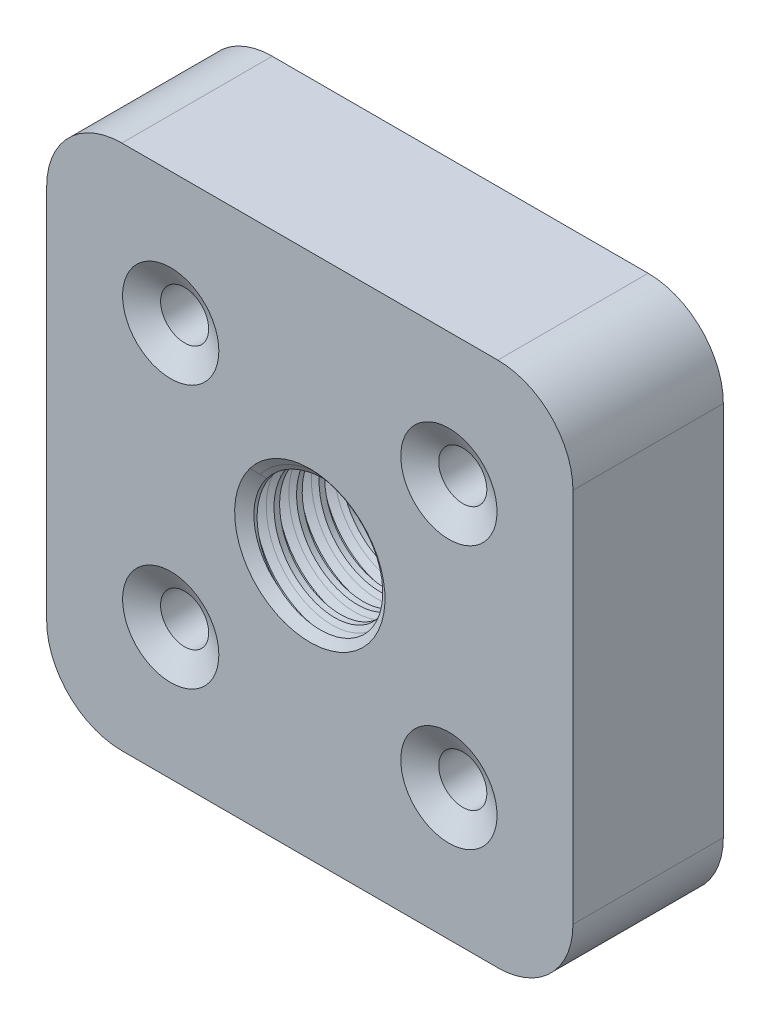
from build123d import *

# Parameters (mm, degrees)
SKETCH1_W                    = 35
SKETCH1_H                    = 35
SKETCH1_R                    = 4.188
SKETCH1_R_2                  = 1.6
BOSS_EXTRUDE1_DEPTH          = 10
CUT_SWEEP1_PITCH             = 1.5
FILLET1_R                    = 5
SKETCH5_R                    = 3.2
CUT_EXTRUDE1_DEPTH           = 1
CUT_EXTRUDE1_DRAFT           = -60
CUT_EXTRUDE1_PROFILE_2_DEPTH = 1
CUT_EXTRUDE1_PROFILE_2_DRAFT = -60
CUT_EXTRUDE1_PROFILE_3_DEPTH = 1
CUT_EXTRUDE1_PROFILE_3_DRAFT = -60
CUT_EXTRUDE1_PROFILE_4_DEPTH = 1
CUT_EXTRUDE1_PROFILE_4_DRAFT = -60


with BuildPart() as part:
    # Sketch1 → Boss-Extrude1 (new body)
    with BuildSketch(Plane.XY):
        Rectangle(SKETCH1_W, SKETCH1_H)
        Circle(SKETCH1_R, mode=Mode.SUBTRACT)
        with Locations((-9.25, 8.75)):
            Circle(SKETCH1_R_2, mode=Mode.SUBTRACT)
        with Locations((9.25, 8.75)):
            Circle(SKETCH1_R_2, mode=Mode.SUBTRACT)
        with Locations((-9.25, -8.75)):
            Circle(SKETCH1_R_2, mode=Mode.SUBTRACT)
        with Locations((9.25, -8.75)):
            Circle(SKETCH1_R_2, mode=Mode.SUBTRACT)
    extrude(amount=BOSS_EXTRUDE1_DEPTH)

    # Cut-Sweep1: the profile of Sketch3 screwed along a right-hand helix of 10 turns, 8 arcs to a turn; built about Z, then put on its axis
    cut_sweep1_z = Axis((0, 0, 0), (0, 0, 1))
    cut_sweep1_corners = [(5, 0, -0.09375), (4.513, 0, -0.375), (4.188, 0, -0.562692505), (4.188, 0, 0), (4.188, 0, 0.562692505), (4.513, 0, 0.375), (5, 0, 0.09375)]
    with BuildLine(mode=Mode.PRIVATE) as cut_sweep1_profile:
        Line(cut_sweep1_corners[0], cut_sweep1_corners[1])
        Line(cut_sweep1_corners[1], cut_sweep1_corners[2])
        Line(cut_sweep1_corners[2], cut_sweep1_corners[3])
        Line(cut_sweep1_corners[3], cut_sweep1_corners[4])
        Line(cut_sweep1_corners[4], cut_sweep1_corners[5])
        Line(cut_sweep1_corners[5], cut_sweep1_corners[6])
        Line(cut_sweep1_corners[6], cut_sweep1_corners[0])
    cut_sweep1_cap = Face(cut_sweep1_profile.wire())
    cut_sweep1_turn_angles = [0, 22.5, 45, 67.5, 90, 112.5, 135, 157.5, 180, 202.5, 225, 247.5, 270, 292.5, 315, 337.5, 360]
    cut_sweep1_turn_weights = [1, 0.9238795325112867, 1, 0.9238795325112867, 1, 0.9238795325112867, 1, 0.9238795325112867, 1, 0.9238795325112867, 1, 0.9238795325112867, 1, 0.9238795325112867, 1, 0.9238795325112867, 1]
    cut_sweep1_turn_rails = [Edge.make_bspline([Vector(p[0], p[1], 0).rotate(cut_sweep1_z, cut_sweep1_turn_angles[k]) / cut_sweep1_turn_weights[k] + Vector(0, 0, p[2] + CUT_SWEEP1_PITCH * cut_sweep1_turn_angles[k] / 360) for k in range(17)], [0, 0, 0, 1, 1, 2, 2, 3, 3, 4, 4, 5, 5, 6, 6, 7, 7, 8, 8, 8], 2, cut_sweep1_turn_weights) for p in cut_sweep1_corners]
    cut_sweep1_turn_sides = [Face.make_surface_from_curves(cut_sweep1_turn_rails[p[0]], cut_sweep1_turn_rails[p[1]]) for p in [(0, 1), (1, 2), (2, 3), (3, 4), (4, 5), (5, 6), (6, 0)]]
    cut_sweep1 = Plane(origin=(0, 0, 12.5), x_dir=(1, 0, 0), z_dir=(0, 0, -1)) * Solid(Shell([*[p.moved(Location((0, 0, CUT_SWEEP1_PITCH * i))) for i in range(10) for p in cut_sweep1_turn_sides], cut_sweep1_cap, cut_sweep1_cap.rotate(cut_sweep1_z, 3600).moved(Location((0, 0, CUT_SWEEP1_PITCH * 3600 / 360)))]))
    add(cut_sweep1, mode=Mode.SUBTRACT)

    # Sketch4 → Cut-Revolve1 (revolve, cut)
    with BuildSketch(Plane(origin=(0, 0, 0), x_dir=(1, 0, 0), z_dir=(0, 1, 0))):
        Polygon((5, -10), (4, -10), (4, -9.422649731), align=None)
        Polygon((5, 0), (4, 0), (4, -0.577350269), align=None)
    revolve(axis=Axis((0, 0, 0), (0, 0, 1)), mode=Mode.SUBTRACT)

    # Fillet1
    fillet1_edges = [part.edges().sort_by_distance(p)[0] for p in [
        (-17.5, -17.5, 5),
        (-17.5, 17.5, 5),
        (17.5, 17.5, 5),
        (17.5, -17.5, 5),
    ]]
    fillet(fillet1_edges, radius=FILLET1_R)


with BuildPart() as cut_extrude1_tool:
    # Sketch5 → Cut-Extrude1 (with draft: the straight prism first)
    with BuildSketch(Plane.XY.offset(10)):
        with Locations((-9.25, 8.75)):
            Circle(SKETCH5_R)
    extrude(amount=-CUT_EXTRUDE1_DEPTH)
    # Cut-Extrude1: the draft: its side faces are tilted about the plane it starts from
    cut_extrude1_sides = [cut_extrude1_tool.faces().sort_by_distance(p)[0] for p in [
        (-12.45, 8.75, 9.5),
    ]]
    draft(cut_extrude1_sides, Plane.XY.offset(10), CUT_EXTRUDE1_DRAFT)


with BuildPart() as part_1:
    add(part.part)

    # Cut-Extrude1: cut by cut_extrude1_tool
    add(cut_extrude1_tool.part, mode=Mode.SUBTRACT)


with BuildPart() as cut_extrude1_profile_2_tool:
    # Sketch5 → Cut-Extrude1 profile 2 (with draft: the straight prism first)
    with BuildSketch(Plane.XY.offset(10)):
        with Locations((9.25, 8.75)):
            Circle(SKETCH5_R)
    extrude(amount=-CUT_EXTRUDE1_PROFILE_2_DEPTH)
    # Cut-Extrude1 profile 2: the draft: its side faces are tilted about the plane it starts from
    cut_extrude1_profile_2_sides = [cut_extrude1_profile_2_tool.faces().sort_by_distance(p)[0] for p in [
        (6.05, 8.75, 9.5),
    ]]
    draft(cut_extrude1_profile_2_sides, Plane.XY.offset(10), CUT_EXTRUDE1_PROFILE_2_DRAFT)


with BuildPart() as part_2:
    add(part_1.part)

    # Cut-Extrude1 profile 2: cut by cut_extrude1_profile_2_tool
    add(cut_extrude1_profile_2_tool.part, mode=Mode.SUBTRACT)


with BuildPart() as cut_extrude1_profile_3_tool:
    # Sketch5 → Cut-Extrude1 profile 3 (with draft: the straight prism first)
    with BuildSketch(Plane.XY.offset(10)):
        with Locations((-9.25, -8.75)):
            Circle(SKETCH5_R)
    extrude(amount=-CUT_EXTRUDE1_PROFILE_3_DEPTH)
    # Cut-Extrude1 profile 3: the draft: its side faces are tilted about the plane it starts from
    cut_extrude1_profile_3_sides = [cut_extrude1_profile_3_tool.faces().sort_by_distance(p)[0] for p in [
        (-12.45, -8.75, 9.5),
    ]]
    draft(cut_extrude1_profile_3_sides, Plane.XY.offset(10), CUT_EXTRUDE1_PROFILE_3_DRAFT)


with BuildPart() as part_3:
    add(part_2.part)

    # Cut-Extrude1 profile 3: cut by cut_extrude1_profile_3_tool
    add(cut_extrude1_profile_3_tool.part, mode=Mode.SUBTRACT)


with BuildPart() as cut_extrude1_profile_4_tool:
    # Sketch5 → Cut-Extrude1 profile 4 (with draft: the straight prism first)
    with BuildSketch(Plane.XY.offset(10)):
        with Locations((9.25, -8.75)):
            Circle(SKETCH5_R)
    extrude(amount=-CUT_EXTRUDE1_PROFILE_4_DEPTH)
    # Cut-Extrude1 profile 4: the draft: its side faces are tilted about the plane it starts from
    cut_extrude1_profile_4_sides = [cut_extrude1_profile_4_tool.faces().sort_by_distance(p)[0] for p in [
        (6.05, -8.75, 9.5),
    ]]
    draft(cut_extrude1_profile_4_sides, Plane.XY.offset(10), CUT_EXTRUDE1_PROFILE_4_DRAFT)


with BuildPart() as part_4:
    add(part_3.part)

    # Cut-Extrude1 profile 4: cut by cut_extrude1_profile_4_tool
    add(cut_extrude1_profile_4_tool.part, mode=Mode.SUBTRACT)


solid = part_4.part
